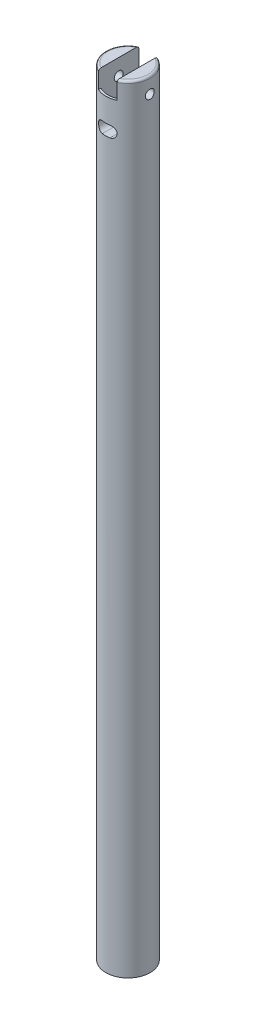
from build123d import *

# Parameters (mm, degrees)
SKETCH_1_R                           = 10
EXTRUDE_1_DEPTH                      = 350
FILLET_1_R                           = 1
CUT_EXTRUDE_6_DEPTH                  = 351.285597766
CUT_EXTRUDE_6_DIRECTION_2_REACH      = 352.286
CUT_EXTRUDE_6_DIRECTION_2_END_RADIUS = 9
CUT_EXTRUDE_7_DEPTH                  = 351.285597868
CUT_EXTRUDE_7_DEPTH_BACK             = 351.285597868
SKETCH_7_W                           = 8.4
SKETCH_7_H                           = 16
CUT_EXTRUDE_START                    = -0.924758876
CUT_EXTRUDE_8_DEPTH                  = 11.924758876
CUT_EXTRUDE_START_2                  = 325
CUT_EXTRUDE_8_2_DEPTH                = 7
CUT_EXTRUDE_9_DEPTH                  = 351.285597868
CUT_EXTRUDE_9_DEPTH_BACK             = 351.285597868
SKETCH_9_R                           = 2


with BuildPart() as part:
    # 草图1 → 凸台-拉伸1 (new body)
    with BuildSketch(Plane(origin=(0, 0, 0), x_dir=(1, 0, 0), z_dir=(0, 1, 0))):
        with Locations(Location((0, 0, 0), (0, 0, 270))):
            Circle(SKETCH_1_R)
    extrude(amount=EXTRUDE_1_DEPTH)

    # 圆角1
    fillet_1_edges = [part.edges().sort_by_distance(p)[0] for p in [
        (0, 350, -10),
    ]]
    fillet(fillet_1_edges, radius=FILLET_1_R)

    # 草图5 → 切除-拉伸6 (cut)
    with BuildSketch(Plane.XY):
        with BuildLine():
            Line((3.2, 334), (-3.2, 334))
            ThreePointArc((-3.2, 334), (-3.907106781, 334.292893219), (-4.2, 335))
            Line((-4.2, 335), (-4.2, 366))
            Line((-4.2, 366), (4.2, 366))
            Line((4.2, 366), (4.2, 335))
            ThreePointArc((4.2, 335), (3.907106781, 334.292893219), (3.2, 334))
        make_face()
    extrude(amount=-CUT_EXTRUDE_6_DEPTH, mode=Mode.SUBTRACT)

    # 切除-拉伸6 direction 2: up to this cylinder (the profile starts inside it)
    cut_extrude_6_direction_2_end = Plane(origin=(0, 350.025231, 0), z_dir=(0, -1, 0)) * Cylinder(CUT_EXTRUDE_6_DIRECTION_2_END_RADIUS, 723.572, mode=Mode.PRIVATE)
    # 草图5 → 切除-拉伸6 direction 2 (cut, up to the surface)
    with BuildSketch(Plane.XY, mode=Mode.PRIVATE) as cut_extrude_6_direction_2_sk1:
        with BuildLine():
            Line((3.2, 334), (-3.2, 334))
            ThreePointArc((-3.2, 334), (-3.907106781, 334.292893219), (-4.2, 335))
            Line((-4.2, 335), (-4.2, 366))
            Line((-4.2, 366), (4.2, 366))
            Line((4.2, 366), (4.2, 335))
            ThreePointArc((4.2, 335), (3.907106781, 334.292893219), (3.2, 334))
        make_face()
    cut_extrude_6_direction_2_tool1 = extrude(cut_extrude_6_direction_2_sk1.sketch, amount=CUT_EXTRUDE_6_DIRECTION_2_REACH, mode=Mode.PRIVATE) & cut_extrude_6_direction_2_end
    add(cut_extrude_6_direction_2_tool1.solids().sort_by_distance((0, 350.025231, 0))[0], mode=Mode.SUBTRACT)

    # 草图7 → 切除-拉伸7 (cut, two sides: drawn at the far end of the back side and taken through both)
    with BuildSketch(Plane.XY.offset(-CUT_EXTRUDE_7_DEPTH_BACK)):
        with Locations((0, 350)):
            Rectangle(SKETCH_7_W, SKETCH_7_H)
    extrude(amount=CUT_EXTRUDE_7_DEPTH + CUT_EXTRUDE_7_DEPTH_BACK, mode=Mode.SUBTRACT)

    # 切除-拉伸8: read off the stored shape, not the designer's step
    # 切除-拉伸8 outline → 切除-拉伸8 (cut)
    with BuildSketch(Plane.XY.offset(CUT_EXTRUDE_START)):
        with BuildLine():
            Line((1.7, 331.484532172), (-1.7, 331.484532172))
            add(Edge.make_bspline(
                [(-1.7, 331.484532172), (-2.36531519, 331.484532172), (-2.999142714, 331.215697613), (-3.916295952, 330.308882303), (-4.198882198, 329.654063239), (-4.20111079, 328.323374921), (-3.920415307, 327.665006461), (-2.997944529, 326.751432928), (-2.365478889, 326.484532172), (-1.7, 326.484532172)],
                knots=[0, 0, 0, 0, 0.25, 0.25, 0.5, 0.5, 0.75, 0.75, 1, 1, 1, 1], degree=3))
            Line((-1.7, 326.484532172), (1.7, 326.484532172))
            add(Edge.make_bspline(
                [(1.7, 326.484532172), (2.36531519, 326.484532172), (2.999142714, 326.75336673), (3.916295952, 327.66018204), (4.198882198, 328.315001104), (4.20111079, 329.645689422), (3.920415307, 330.304057882), (2.997944529, 331.217631415), (2.365478889, 331.484532172), (1.7, 331.484532172)],
                knots=[0, 0, 0, 0, 0.25, 0.25, 0.5, 0.5, 0.75, 0.75, 1, 1, 1, 1], degree=3))
        make_face()
    extrude(amount=CUT_EXTRUDE_8_DEPTH, mode=Mode.SUBTRACT)

    # Cut-Extrude 8 2 outline → Cut-Extrude 8 2 (add)
    with BuildSketch(Plane(origin=(0, 0, 0), x_dir=(1, 0, 0), z_dir=(0, 1, 0)).offset(CUT_EXTRUDE_START_2)):
        with BuildLine():
            ThreePointArc((-4.199999886, 0.924758903), (0, 0), (4.199999886, 0.924758903))
            Line((4.199999886, 0.924758903), (-4.199999886, 0.924758903))
        make_face()
    extrude(amount=CUT_EXTRUDE_8_2_DEPTH)

    # 草图9 → 切除-拉伸9 (cut, two sides: drawn at the far end of the back side and taken through both)
    with BuildSketch(Plane(origin=(0, 0, 0), x_dir=(0, 0, -1), z_dir=(1, 0, 0)).offset(-CUT_EXTRUDE_9_DEPTH_BACK)):
        with Locations((0, 342.814995951)):
            Circle(SKETCH_9_R)
    extrude(amount=CUT_EXTRUDE_9_DEPTH + CUT_EXTRUDE_9_DEPTH_BACK, mode=Mode.SUBTRACT)


solid = part.part
